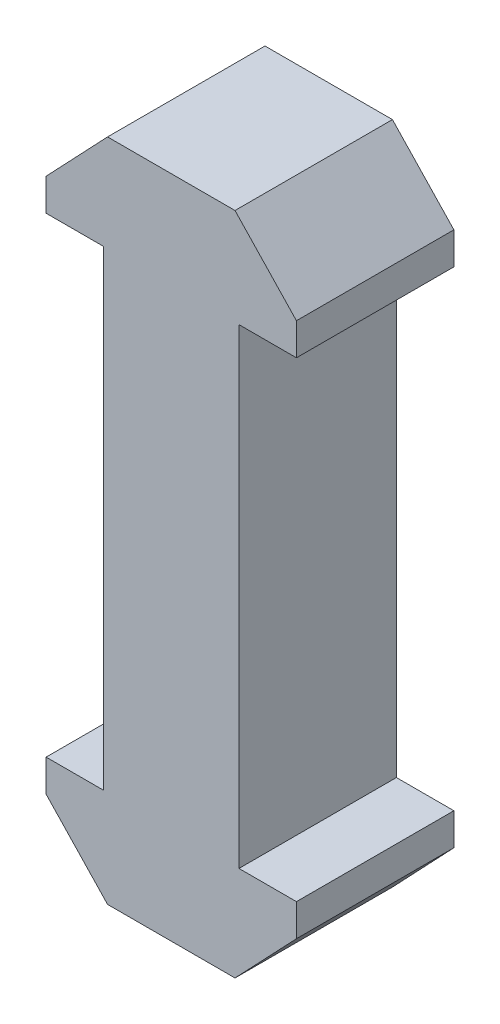
from build123d import *

# Parameters (mm, degrees)
BOSS_EXTRUDE1_DEPTH = 5


with BuildPart() as part:
    # Sketch1 → Boss-Extrude1 (new, symmetric)
    with BuildSketch(Plane.XY):
        Polygon((4.3, -2.122480699), (4.3, 27.792519301), (7.95, 27.792519301), (7.95, 29.832519301), (4.048, 33.944934285), (-4.048, 33.944934285), (-7.95, 29.832519301), (-7.95, 27.792519301), (-4.3, 27.792519301), (-4.3, -2.122480699), (-7.95, -2.122480699), (-7.95, -4.162480699), (-4.048, -8.274895683), (4.048, -8.274895683), (7.95, -4.162480699), (7.95, -2.122480699), align=None)
    extrude(amount=BOSS_EXTRUDE1_DEPTH, both=True)


solid = part.part
